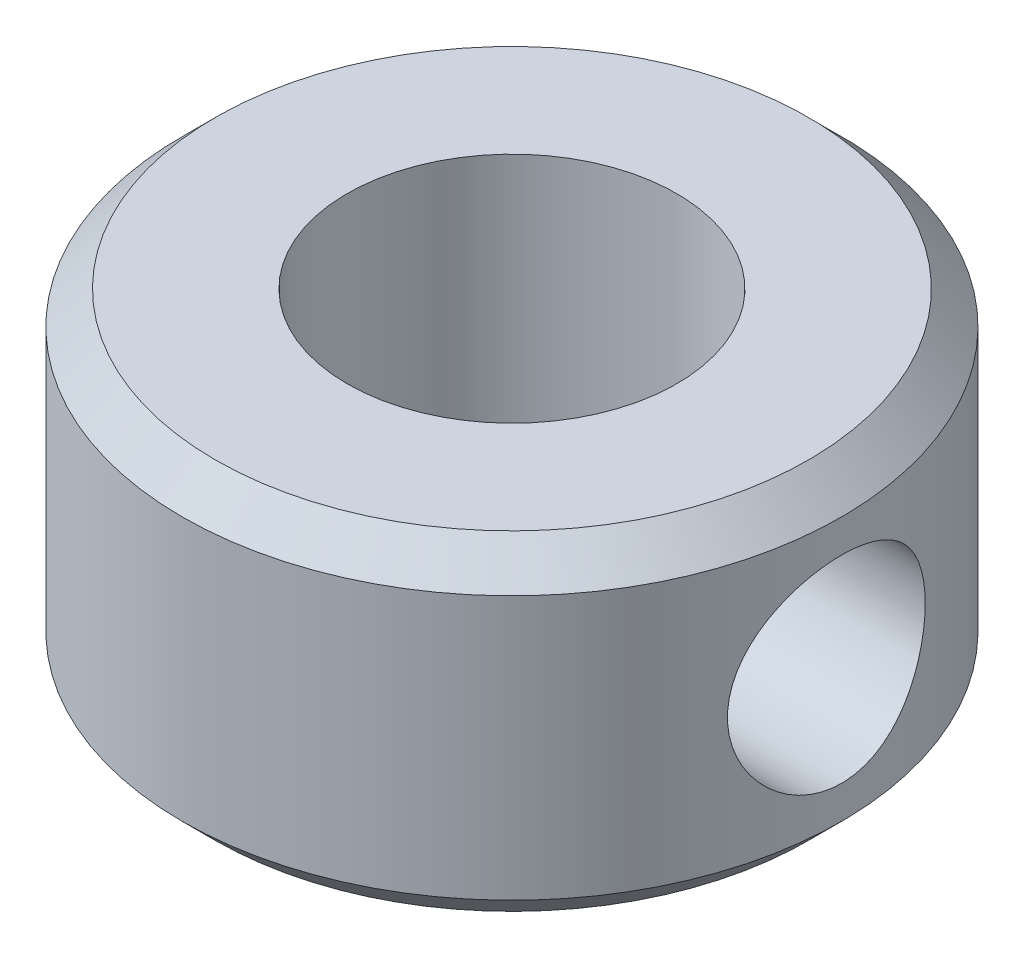
from build123d import *

# Parameters (mm, degrees)
SKETCH1_R               = 5
SKETCH1_R_2             = 2.5
BOSS_EXTRUDE1_DEPTH     = 5
CUT_EXTRUDE1_REACH      = 14.247
CUT_EXTRUDE1_END_RADIUS = 2.5
SKETCH2_R               = 1.5
CHAMFER1_SIZE           = 0.5


with BuildPart() as part:
    # Sketch1 → Boss-Extrude1 (new body)
    with BuildSketch(Plane(origin=(0, 0, 0), x_dir=(1, 0, 0), z_dir=(0, 1, 0))):
        Circle(SKETCH1_R)
        Circle(SKETCH1_R_2, mode=Mode.SUBTRACT)
    extrude(amount=BOSS_EXTRUDE1_DEPTH)

    # Cut-Extrude1: up to this cylinder (the profile starts outside it)
    cut_extrude1_end = Plane(origin=(0, 2.5, 0), z_dir=(0, -1, 0)) * Cylinder(CUT_EXTRUDE1_END_RADIUS, 34.494, mode=Mode.PRIVATE)
    # Sketch2 → Cut-Extrude1 (cut, up to the surface)
    with BuildSketch(Plane(origin=(5, 0, 0), x_dir=(0, 0, -1), z_dir=(1, 0, 0)), mode=Mode.PRIVATE) as cut_extrude1_sk1:
        with Locations((0, 2.5)):
            Circle(SKETCH2_R)
    cut_extrude1_tool1 = extrude(cut_extrude1_sk1.sketch, amount=-CUT_EXTRUDE1_REACH, mode=Mode.PRIVATE) - cut_extrude1_end
    add(cut_extrude1_tool1.solids().sort_by_distance((5, 2.5, 0))[0], mode=Mode.SUBTRACT)

    # Chamfer1
    chamfer1_edges = [part.edges().sort_by_distance(p)[0] for p in [
        (-5, 0, 0),
        (-5, 5, 0),
    ]]
    chamfer(chamfer1_edges, length=CHAMFER1_SIZE)


solid = part.part
